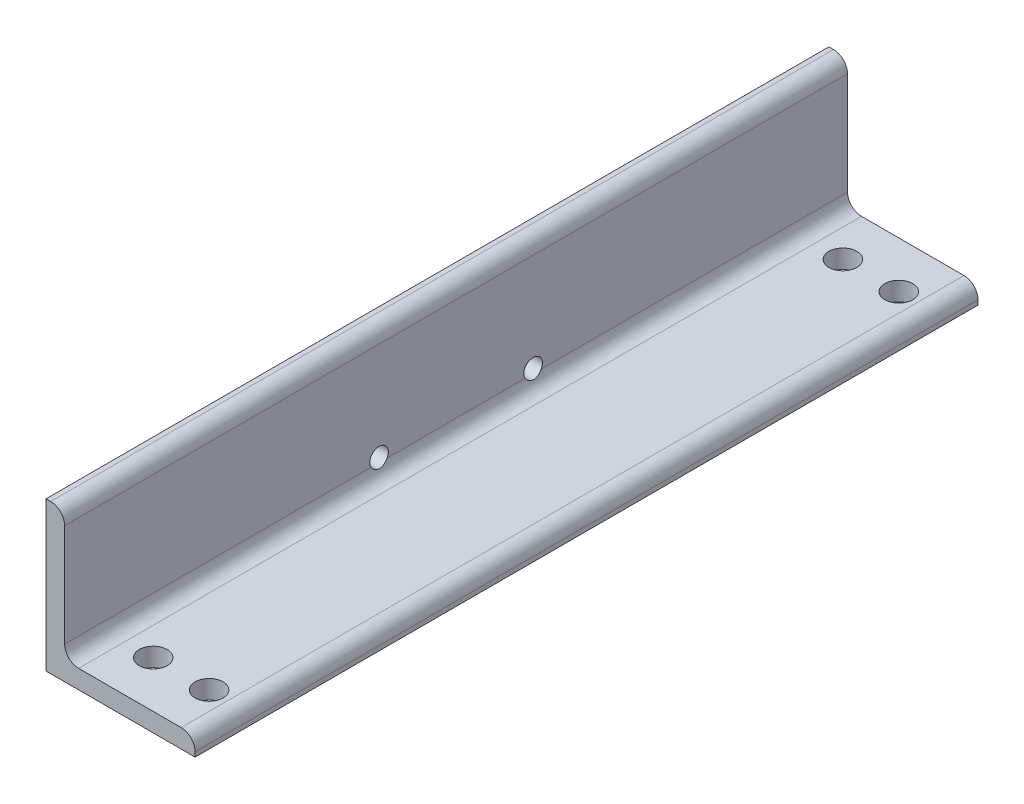
from build123d import *

# Parameters (mm, degrees)
BOSS_EXTRUDE1_DEPTH = 266.7
CUT_EXTRUDE1_REACH  = 293.271
SKETCH3_R           = 9.525
CUT_EXTRUDE2_REACH  = 304.942
SKETCH4_R           = 6.35


with BuildPart() as part:
    # Sketch1 → Boss-Extrude1 (new, symmetric)
    with BuildSketch(Plane.XY):
        with BuildLine():
            Line((0, 0), (0, 101.6))
            Line((0, 101.6), (3.18008, 101.6))
            ThreePointArc((3.18008, 101.6), (9.911679988, 98.811679988), (12.7, 92.08008))
            Line((12.7, 92.08008), (12.7, 22.225))
            ThreePointArc((12.7, 22.225), (15.489807909, 15.489807909), (22.225, 12.7))
            Line((22.225, 12.7), (92.08008, 12.7))
            ThreePointArc((92.08008, 12.7), (98.811679988, 9.911679988), (101.6, 3.18008))
            Line((101.6, 3.18008), (101.6, 0))
            Line((101.6, 0), (0, 0))
        make_face()
    extrude(amount=BOSS_EXTRUDE1_DEPTH, both=True)

    # Sketch3 → Cut-Extrude1 (cut, up to next)
    with BuildSketch(Plane(origin=(25.4, 12.7, 0), x_dir=(0, 0, -1), z_dir=(0, 1, 0)), mode=Mode.PRIVATE) as cut_extrude1_sk1:
        with Locations((234.95, -15.875)):
            Circle(SKETCH3_R)
    cut_extrude1_tool1 = extrude(cut_extrude1_sk1.sketch, amount=-CUT_EXTRUDE1_REACH, mode=Mode.PRIVATE) & part.part
    # Sketch3 → Cut-Extrude1 (cut, up to next)
    with BuildSketch(Plane(origin=(25.4, 12.7, 0), x_dir=(0, 0, -1), z_dir=(0, 1, 0)), mode=Mode.PRIVATE) as cut_extrude1_sk2:
        with Locations((-234.95, -15.875)):
            Circle(SKETCH3_R)
    cut_extrude1_tool2 = extrude(cut_extrude1_sk2.sketch, amount=-CUT_EXTRUDE1_REACH, mode=Mode.PRIVATE) & part.part
    # Sketch3 → Cut-Extrude1 (cut, up to next)
    with BuildSketch(Plane(origin=(25.4, 12.7, 0), x_dir=(0, 0, -1), z_dir=(0, 1, 0)), mode=Mode.PRIVATE) as cut_extrude1_sk3:
        with Locations((-234.95, -53.975)):
            Circle(SKETCH3_R)
    cut_extrude1_tool3 = extrude(cut_extrude1_sk3.sketch, amount=-CUT_EXTRUDE1_REACH, mode=Mode.PRIVATE) & part.part
    # Sketch3 → Cut-Extrude1 (cut, up to next)
    with BuildSketch(Plane(origin=(25.4, 12.7, 0), x_dir=(0, 0, -1), z_dir=(0, 1, 0)), mode=Mode.PRIVATE) as cut_extrude1_sk4:
        with Locations((234.95, -53.975)):
            Circle(SKETCH3_R)
    cut_extrude1_tool4 = extrude(cut_extrude1_sk4.sketch, amount=-CUT_EXTRUDE1_REACH, mode=Mode.PRIVATE) & part.part
    add(cut_extrude1_tool1.solids().sort_by_distance((41.275, 12.7, -234.95))[0], mode=Mode.SUBTRACT)
    add(cut_extrude1_tool2.solids().sort_by_distance((41.275, 12.7, 234.95))[0], mode=Mode.SUBTRACT)
    add(cut_extrude1_tool3.solids().sort_by_distance((79.375, 12.7, 234.95))[0], mode=Mode.SUBTRACT)
    add(cut_extrude1_tool4.solids().sort_by_distance((79.375, 12.7, -234.95))[0], mode=Mode.SUBTRACT)

    # Sketch4 → Cut-Extrude2 (cut, up to next)
    with BuildSketch(Plane.ZY, mode=Mode.PRIVATE) as cut_extrude2_sk1:
        with Locations((-52.4891, 25.4)):
            Circle(SKETCH4_R)
    cut_extrude2_tool1 = extrude(cut_extrude2_sk1.sketch, amount=-CUT_EXTRUDE2_REACH, mode=Mode.PRIVATE) & part.part
    # Sketch4 → Cut-Extrude2 (cut, up to next)
    with BuildSketch(Plane.ZY, mode=Mode.PRIVATE) as cut_extrude2_sk2:
        with Locations((52.4891, 25.4)):
            Circle(SKETCH4_R)
    cut_extrude2_tool2 = extrude(cut_extrude2_sk2.sketch, amount=-CUT_EXTRUDE2_REACH, mode=Mode.PRIVATE) & part.part
    add(cut_extrude2_tool1.solids().sort_by_distance((0, 25.4, -52.4891))[0], mode=Mode.SUBTRACT)
    add(cut_extrude2_tool2.solids().sort_by_distance((0, 25.4, 52.4891))[0], mode=Mode.SUBTRACT)


solid = part.part
